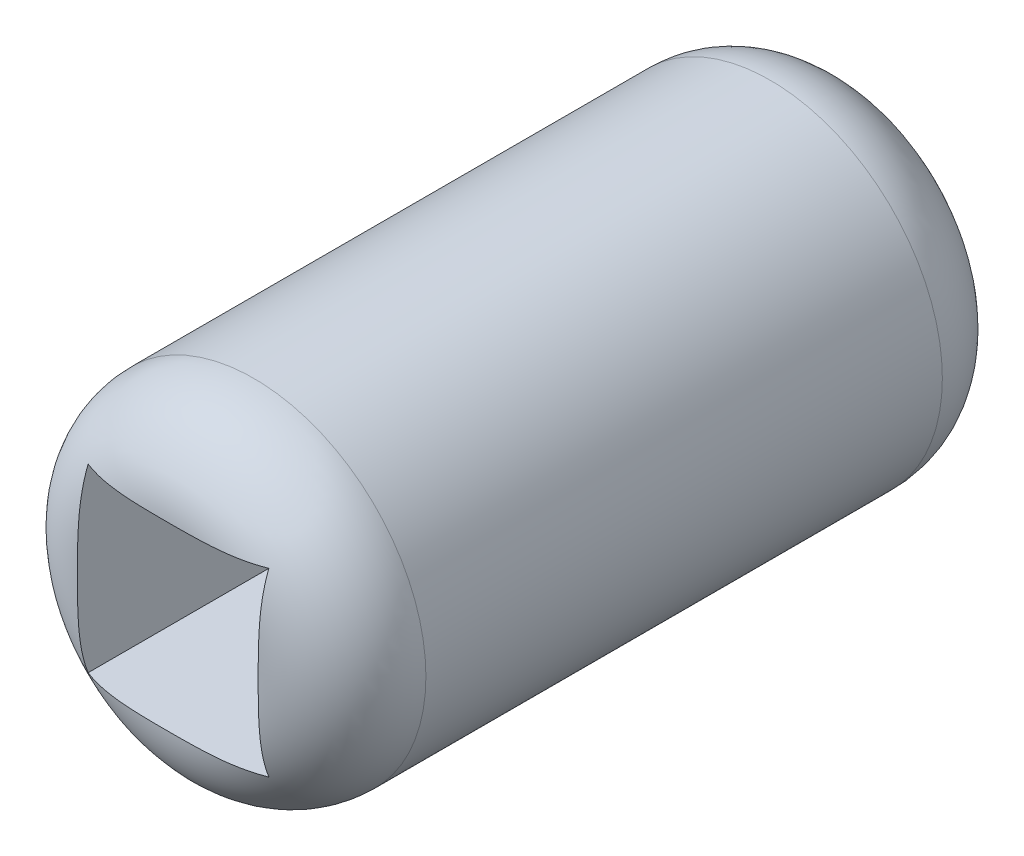
from build123d import *

# Parameters (mm, degrees)
SKETCH4_R               = 20
BODY_DEPTH              = 80
CUT_EXTRUDE1_DEPTH      = 50
CUT_EXTRUDE1_DEPTH_BACK = 50
SKETCH16_W              = 21
SKETCH16_H              = 21
SKETCH17_R              = 2.55
CUT_EXTRUDE2_DEPTH      = 55
SKETCH18_R              = 7
CUT_EXTRUDE3_DEPTH      = 3
FILLET1_R               = 10


with BuildPart() as part:
    # Sketch4 → Body (new body)
    with BuildSketch(Plane.XY.offset(25)):
        Circle(SKETCH4_R)
    extrude(amount=-BODY_DEPTH)

    # Sketch16 → Cut-Extrude1 (cut, two sides: drawn at the far end of the back side and taken through both)
    with BuildSketch(Plane.XY.offset(-CUT_EXTRUDE1_DEPTH_BACK)):
        Rectangle(SKETCH16_W, SKETCH16_H)
    extrude(amount=CUT_EXTRUDE1_DEPTH + CUT_EXTRUDE1_DEPTH_BACK, mode=Mode.SUBTRACT)

    # Sketch17 → Cut-Extrude2 (cut)
    with BuildSketch(Plane(origin=(0, 0, -55), x_dir=(-1, 0, 0), z_dir=(0, 0, -1))):
        Circle(SKETCH17_R)
    extrude(amount=-CUT_EXTRUDE2_DEPTH, mode=Mode.SUBTRACT)

    # Sketch18 → Cut-Extrude3 (cut)
    with BuildSketch(Plane(origin=(0, 0, -55), x_dir=(-1, 0, 0), z_dir=(0, 0, -1))):
        Circle(SKETCH18_R)
    extrude(amount=-CUT_EXTRUDE3_DEPTH, mode=Mode.SUBTRACT)

    # Fillet1
    # the kernel refuses this fillet: 10 mm, written as the material it takes off along each edge
    with BuildSketch(Plane(origin=(0, 0, 25), x_dir=(1, 0, 0), z_dir=(0, -1, 0))) as fillet1_piece_1:
        with BuildLine():
            CenterArc((20 - FILLET1_R, -FILLET1_R), FILLET1_R, 0, 90)
            Line((20 - FILLET1_R, 0), (20, 0))
            Line((20, 0), (20, -FILLET1_R))
        make_face()
    revolve(axis=Axis((0, 0, 25), (0, 0, 1)), mode=Mode.SUBTRACT)
    with BuildSketch(Plane(origin=(0, 0, -55), x_dir=(1, 0, 0), z_dir=(0, -1, 0))) as fillet1_piece_2:
        with BuildLine():
            CenterArc((20 - FILLET1_R, FILLET1_R), FILLET1_R, 270, 90)
            Line((20 - FILLET1_R, 0), (20, 0))
            Line((20, 0), (20, FILLET1_R))
        make_face()
    revolve(axis=Axis((0, 0, -55), (0, 0, 1)), mode=Mode.SUBTRACT)


solid = part.part
